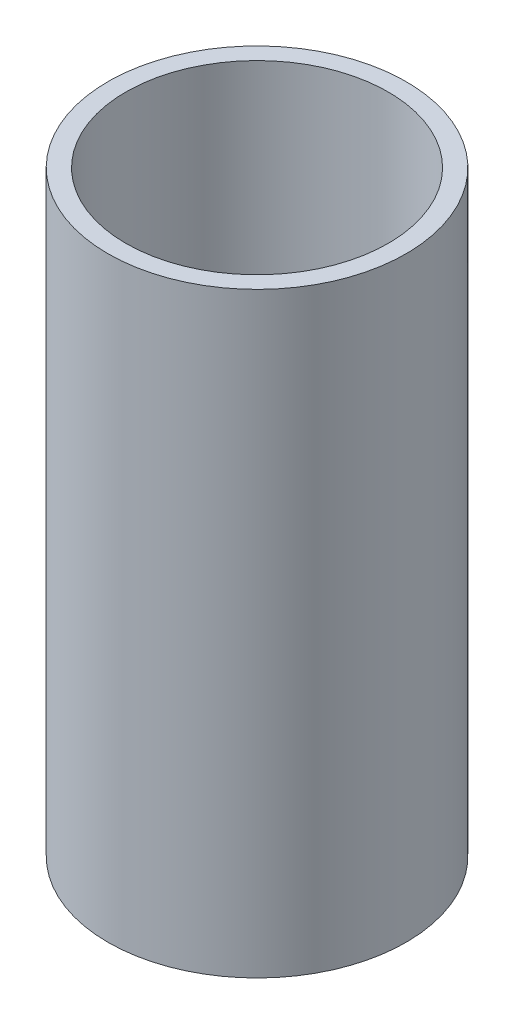
from build123d import *

# Parameters (mm, degrees)
SKETCH_1_R      = 25
SKETCH_1_R_2    = 22
EXTRUDE_1_DEPTH = 100


with BuildPart() as part:
    # 草圖1 → 填料-伸長1 (new body)
    with BuildSketch(Plane(origin=(0, 0, 0), x_dir=(1, 0, 0), z_dir=(0, 1, 0))):
        Circle(SKETCH_1_R)
        Circle(SKETCH_1_R_2, mode=Mode.SUBTRACT)
    extrude(amount=EXTRUDE_1_DEPTH)


solid = part.part
